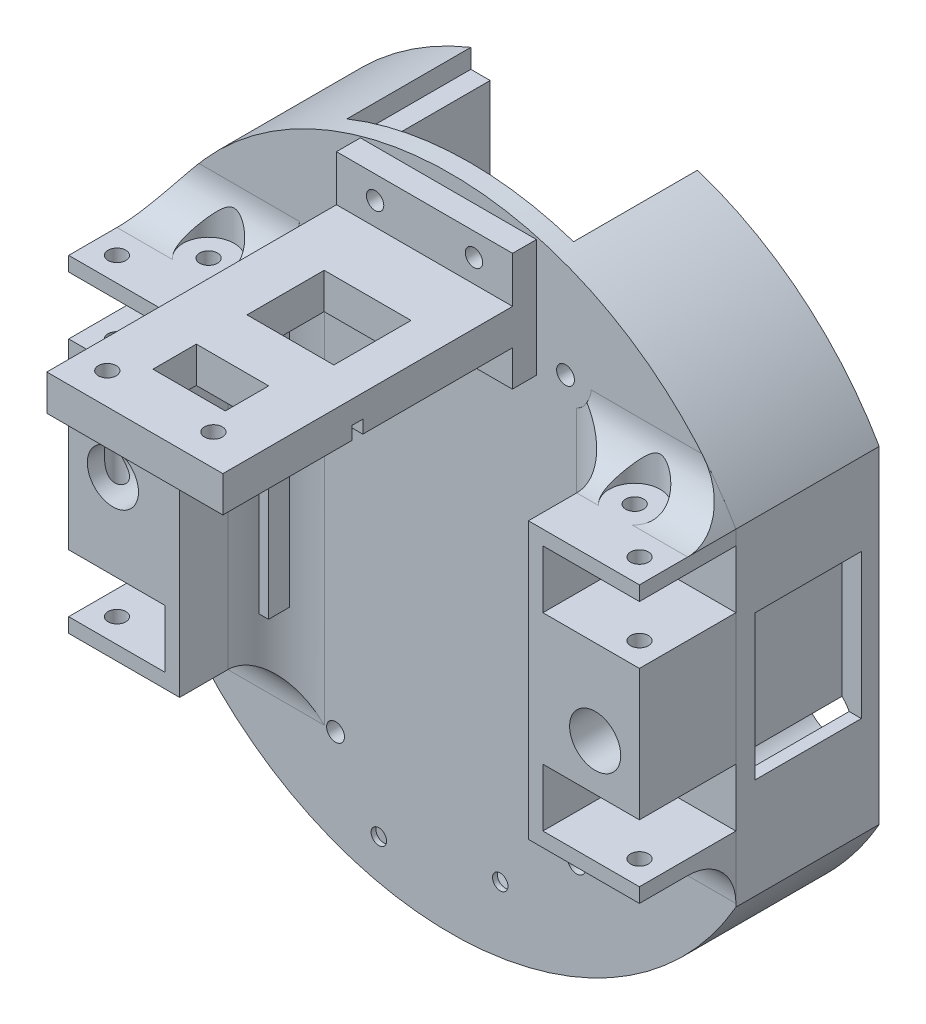
from build123d import *

# Parameters (mm, degrees)
SALIENTE_EXTRUIR2_DEPTH  = 25.7
CROQUIS3_R               = 68.187967498
SALIENTE_EXTRUIR3_DEPTH  = 4
CORTAR_EXTRUIR1_REACH    = 275.509
CROQUIS7_W               = 25
CROQUIS7_H               = 54.5
CORTAR_EXTRUIR2_DEPTH    = 2
CROQUIS8_R               = 1.6
CORTAR_EXTRUIR3_DEPTH    = 10
CROQUIS9_W               = 22
CROQUIS9_H               = 30
CORTAR_EXTRUIR4_DEPTH    = 4
CROQUIS10_R              = 1.85
CORTAR_EXTRUIR5_DEPTH    = 271.994192832
CROQUIS11_W              = 36.494454581
CROQUIS11_H              = 14.83840461
SALIENTE_EXTRUIR4_DEPTH  = 5
CROQUIS12_W              = 36.494454581
CROQUIS12_H              = 7.419202305
SALIENTE_EXTRUIR5_DEPTH  = 60
CROQUIS13_W              = 2.197225814
CROQUIS13_H              = 2.698054226
CORTAR_EXTRUIR6_DEPTH    = 288.011284081
CROQUIS15_W              = 2
CROQUIS15_H              = 49.489125547
SALIENTE_EXTRUIR6_DEPTH  = 6
CROQUIS16_R              = 1.6
CORTAR_EXTRUIR7_DEPTH    = 10
CROQUIS17_R              = 1.85
CORTAR_EXTRUIR8_DEPTH    = 167.163173861
CROQUIS23_W              = 25.422767162
CROQUIS23_H              = 18
CROQUIS23_W_2            = 26.870888419
SALIENTE_EXTRUIR8_DEPTH  = 20
CROQUIS24_W              = 20
CROQUIS24_H              = 12
CROQUIS24_W_2            = 2.422767162
CROQUIS24_H_2            = 18
CROQUIS24_W_3            = 3.870888419
CORTAR_EXTRUIR12_DEPTH   = 20
CROQUIS25_R              = 1.85
CORTAR_EXTRUIR13_DEPTH   = 157.420786096
CROQUIS26_R              = 7
CORTAR_EXTRUIR14_DEPTH   = 23
CORTAR_EXTRUIR15_DEPTH   = 3
CROQUIS28_W              = 15
CROQUIS28_H              = 9
CROQUIS28_W_2            = 18
CROQUIS28_H_2            = 16
CORTAR_EXTRUIR16_DEPTH   = 10
SALIENTE_EXTRUIR9_START  = -7.419202305
CROQUIS29_R              = 1.85
SALIENTE_EXTRUIR9_DEPTH  = 7.419202305
CROQUIS30_W              = 23
CROQUIS30_H              = 31.860199641
CROQUIS30_R              = 5.3
CROQUIS30_H_2            = 21.18941166
SALIENTE_EXTRUIR10_DEPTH = 20
CROQUIS31_R              = 1.85
CORTAR_EXTRUIR17_DEPTH   = 157.420786096
REDONDEO2_R              = 10
CROQUIS32_R              = 5.3
CORTAR_EXTRUIR18_DEPTH   = 278.093418476
CROQUIS33_R              = 5.3
CORTAR_EXTRUIR19_DEPTH   = 10
CORTAR_EXTRUIR21_START   = 10
CROQUIS35_R              = 5.3
CORTAR_EXTRUIR21_DEPTH   = 10
CROQUIS37_R              = 5.3
CORTAR_EXTRUIR23_DEPTH   = 10
CROQUIS38_W              = 4.954639541
CROQUIS38_H              = 9.52618695
SALIENTE_EXTRUIR11_DEPTH = 36.494454581
CROQUIS39_R              = 1.8
CORTAR_EXTRUIR24_DEPTH   = 276.972637799
CORTAR_EXTRUIR25_DEPTH   = 3


with BuildPart() as part:
    # Croquis1 → Saliente-Extruir2 (new body)
    with BuildSketch(Plane.XY):
        with BuildLine():
            Line((-13.423815297, -132.294446721), (-13.423815297, -128.345307712))
            ThreePointArc((-13.423815297, -128.345307712), (-26.08823443, -248.103961959), (80.254008279, -191.589802718))
            ThreePointArc((80.254008279, -191.589802718), (67.366727513, -151.697034471), (33.576184703, -126.883445844))
            Line((33.576184703, -126.883445844), (33.576184703, -153.323488747))
            ThreePointArc((33.576184703, -153.323488747), (49.955618696, -169.422778516), (55.963615617, -191.589802718))
            ThreePointArc((55.963615617, -191.589802718), (49.955618696, -213.756826921), (33.576184703, -229.85611669))
            Line((33.576184703, -229.85611669), (33.576184703, -256.294446721))
            Line((33.576184703, -256.294446721), (-9.423815297, -256.294446721))
            Line((-9.423815297, -256.294446721), (-9.423815297, -229.867513756))
            ThreePointArc((-9.423815297, -229.867513756), (-31.831534056, -191.589802718), (-9.423815297, -153.312091681))
            Line((-9.423815297, -153.312091681), (-9.423815297, -132.294446721))
            Line((-9.423815297, -132.294446721), (-13.423815297, -132.294446721))
        make_face()
    extrude(amount=SALIENTE_EXTRUIR2_DEPTH)

    # Croquis3 → Saliente-Extruir3 (add)
    with BuildSketch(Plane.XY.offset(25.7)):
        with Locations(Location((12.066040781, -191.589802718, 0), (0, 0, 111.951246448))):
            Circle(CROQUIS3_R)
    extrude(amount=SALIENTE_EXTRUIR3_DEPTH)

    # Croquis6 → Cortar-Extruir1 (cut, up to next)
    with BuildSketch(Plane.XY.offset(29.7), mode=Mode.PRIVATE) as cortar_extruir1_sk1:
        with BuildLine():
            Line((-47.08078701, -225.519902539), (-47.08078701, -157.659702898))
            ThreePointArc((-47.08078701, -157.659702898), (-56.121926717, -191.589802718), (-47.08078701, -225.519902539))
        make_face()
    cortar_extruir1_tool1 = extrude(cortar_extruir1_sk1.sketch, amount=-CORTAR_EXTRUIR1_REACH, mode=Mode.PRIVATE) & part.part
    # Croquis6 → Cortar-Extruir1 (cut, up to next)
    with BuildSketch(Plane.XY.offset(29.7), mode=Mode.PRIVATE) as cortar_extruir1_sk2:
        with BuildLine():
            ThreePointArc((80.254008279, -191.589802718), (77.954965808, -174.032796418), (71.212868571, -157.659702898))
            Line((71.212868571, -157.659702898), (71.212868571, -225.519902539))
            ThreePointArc((71.212868571, -225.519902539), (77.954965808, -209.146809019), (80.254008279, -191.589802718))
        make_face()
    cortar_extruir1_tool2 = extrude(cortar_extruir1_sk2.sketch, amount=-CORTAR_EXTRUIR1_REACH, mode=Mode.PRIVATE) & part.part
    add(cortar_extruir1_tool1.solids().sort_by_distance((-50.718614, -191.589803, 29.7))[0], mode=Mode.SUBTRACT)
    add(cortar_extruir1_tool2.solids().sort_by_distance((74.850696, -191.589803, 29.7))[0], mode=Mode.SUBTRACT)

    # Croquis7 → Cortar-Extruir2 (cut)
    with BuildSketch(Plane.ZY.offset(47.08078701)):
        with Locations((15.2, -191.909702898)):
            Rectangle(CROQUIS7_W, CROQUIS7_H)
    extrude(amount=-CORTAR_EXTRUIR2_DEPTH, mode=Mode.SUBTRACT)

    # Croquis8 → Cortar-Extruir3 (cut)
    with BuildSketch(Plane.ZY.offset(45.08078701)):
        with Locations((5.7, -209.159702898)):
            Circle(CROQUIS8_R)
        with Locations((24.7, -174.959702898)):
            Circle(CROQUIS8_R)
    extrude(amount=-CORTAR_EXTRUIR3_DEPTH, mode=Mode.SUBTRACT)

    # Croquis9 → Cortar-Extruir4 (cut)
    with BuildSketch(Plane(origin=(71.212868571, 0, 0), x_dir=(0, 0, -1), z_dir=(1, 0, 0))):
        with Locations((-14.7, -189.659702898)):
            Rectangle(CROQUIS9_W, CROQUIS9_H)
    extrude(amount=-CORTAR_EXTRUIR4_DEPTH, mode=Mode.SUBTRACT)

    # Croquis10 → Cortar-Extruir5 (cut, through all)
    with BuildSketch(Plane(origin=(0, 0, 0), x_dir=(-1, 0, 0), z_dir=(0, 0, -1))):
        with Locations((11.768253413, -235.543487664)):
            Circle(CROQUIS10_R)
        with Locations((-38.213901437, -234.207749444)):
            Circle(CROQUIS10_R)
        with Locations((37.916114069, -192.925540938)):
            Circle(CROQUIS10_R)
        with Locations((-62.048195631, -190.254064499)):
            Circle(CROQUIS10_R)
        with Locations((-35.900334975, -147.636117773)):
            Circle(CROQUIS10_R)
        with Locations((14.081819875, -148.971855993)):
            Circle(CROQUIS10_R)
    extrude(amount=-CORTAR_EXTRUIR5_DEPTH, mode=Mode.SUBTRACT)

    # Croquis11 → Saliente-Extruir4 (add)
    with BuildSketch(Plane.XY.offset(29.7)):
        with Locations((11.63234752, -143.283831758)):
            Rectangle(CROQUIS11_W, CROQUIS11_H)
    extrude(amount=SALIENTE_EXTRUIR4_DEPTH)

    # Croquis12 → Saliente-Extruir5 (add)
    with BuildSketch(Plane.XY.offset(34.7)):
        with Locations((11.63234752, -139.574230606)):
            Rectangle(CROQUIS12_W, CROQUIS12_H)
    extrude(amount=SALIENTE_EXTRUIR5_DEPTH)

    # Croquis13 → Cortar-Extruir6 (cut, through all)
    with BuildSketch(Plane(origin=(29.879574811, 0, 0), x_dir=(0, 0, -1), z_dir=(1, 0, 0))):
        with Locations((-66.794067754, -141.934804645)):
            Rectangle(CROQUIS13_W, CROQUIS13_H)
    extrude(amount=-CORTAR_EXTRUIR6_DEPTH, mode=Mode.SUBTRACT)

    # Croquis15 → Saliente-Extruir6 (add)
    with BuildSketch(Plane.XY.offset(29.7)):
        with Locations((-20.658019848, -191.540467922)):
            Rectangle(CROQUIS15_W, CROQUIS15_H)
        with Locations((43.341980152, -191.540467922)):
            Rectangle(CROQUIS15_W, CROQUIS15_H)
    extrude(amount=SALIENTE_EXTRUIR6_DEPTH)

    # Croquis16 → Cortar-Extruir7 (cut)
    with BuildSketch(Plane.XY.offset(29.7)):
        with Locations((-2.795177489, -249.862416258)):
            Circle(CROQUIS16_R)
        with Locations((22.369152578, -245.40207204)):
            Circle(CROQUIS16_R)
    extrude(amount=-CORTAR_EXTRUIR7_DEPTH, mode=Mode.SUBTRACT)

    # Croquis17 → Cortar-Extruir8 (cut, through all)
    with BuildSketch(Plane(origin=(0, -143.283831758, 0), x_dir=(-1, 0, 0), z_dir=(0, -1, 0))):
        with Locations(Location((0.577969088, -88.2, 0), (0, 0, 90))):
            Circle(CROQUIS17_R)
        with Locations(Location((-10.071096588, -88.2, 0), (0, 0, 90))):
            Circle(CROQUIS17_R)
        with Locations(Location((-21.422030912, -88.2, 0), (0, 0, 90))):
            Circle(CROQUIS17_R)
    extrude(amount=-CORTAR_EXTRUIR8_DEPTH, mode=Mode.SUBTRACT)

    # Croquis23 → Saliente-Extruir8 (add)
    with BuildSketch(Plane.XY.offset(29.7)):
        with Locations((-34.369403429, -166.659702898)):
            Rectangle(CROQUIS23_W, CROQUIS23_H)
        with Locations((-34.369403429, -216.519902539)):
            Rectangle(CROQUIS23_W, CROQUIS23_H)
        with Locations((57.777424362, -166.659702898)):
            Rectangle(CROQUIS23_W_2, CROQUIS23_H)
        with Locations((57.777424362, -205.849114558)):
            Rectangle(CROQUIS23_W_2, CROQUIS23_H)
    extrude(amount=SALIENTE_EXTRUIR8_DEPTH)

    # Croquis24 → Cortar-Extruir12 (cut)
    with BuildSketch(Plane.XY.offset(49.7)):
        with Locations((-37.08078701, -166.659702898)):
            Rectangle(CROQUIS24_W, CROQUIS24_H)
        with Locations((-37.08078701, -216.519902539)):
            Rectangle(CROQUIS24_W, CROQUIS24_H)
        with Locations((61.212868571, -166.659702898)):
            Rectangle(CROQUIS24_W, CROQUIS24_H)
        with Locations((61.212868571, -205.849114558)):
            Rectangle(CROQUIS24_W, CROQUIS24_H)
        with Locations((-22.869403429, -166.659702898)):
            Rectangle(CROQUIS24_W_2, CROQUIS24_H_2)
        with Locations((-22.869403429, -216.519902539)):
            Rectangle(CROQUIS24_W_2, CROQUIS24_H_2)
        with Locations((46.277424362, -166.659702898)):
            Rectangle(CROQUIS24_W_3, CROQUIS24_H_2)
        with Locations((46.277424362, -205.849114558)):
            Rectangle(CROQUIS24_W_3, CROQUIS24_H_2)
    extrude(amount=-CORTAR_EXTRUIR12_DEPTH, mode=Mode.SUBTRACT)

    # Croquis25 → Cortar-Extruir13 (cut, through all)
    with BuildSketch(Plane(origin=(0, -157.659702898, 0), x_dir=(1, 0, 0), z_dir=(0, 1, 0))):
        with Locations(Location((-42.08078701, -44.7, 0), (0, 0, 270))):
            Circle(CROQUIS25_R)
        with Locations(Location((-32.08078701, -35.7, 0), (0, 0, 270))):
            Circle(CROQUIS25_R)
        with Locations(Location((66.233156416, -44.7, 0), (0, 0, 270))):
            Circle(CROQUIS25_R)
        with Locations(Location((56.233156416, -35.7, 0), (0, 0, 270))):
            Circle(CROQUIS25_R)
    extrude(amount=-CORTAR_EXTRUIR13_DEPTH, mode=Mode.SUBTRACT)

    # Croquis26 → Cortar-Extruir14 (cut)
    with BuildSketch(Plane(origin=(0, 0, 0), x_dir=(-1, 0, 0), z_dir=(0, 0, -1))):
        with Locations((34.679916564, -216.470406453)):
            Circle(CROQUIS26_R)
        with Locations((34.679916564, -167.641891075)):
            Circle(CROQUIS26_R)
        with Locations(Location((-58.811998126, -167.641891075, 0), (0, 0, 180))):
            Circle(CROQUIS26_R)
        with Locations(Location((-62.399975323, -207.748824541, 0), (0, 0, 133.436969184))):
            Circle(CROQUIS26_R)
    extrude(amount=-CORTAR_EXTRUIR14_DEPTH, mode=Mode.SUBTRACT)

    # Croquis27 → Cortar-Extruir15 (cut)
    with BuildSketch(Plane(origin=(0, 0, 25.7), x_dir=(-1, 0, 0), z_dir=(0, 0, -1))):
        Polygon((-25.714624157, -247.869422828), (-21.905099905, -249.53301081), (-18.559628325, -247.065660022), (-19.023680998, -242.934721252), (-22.83320525, -241.271133271), (-26.17867683, -243.738484058), align=None)
        Polygon((0.321506024, -253.203216983), (4.451560053, -253.67507895), (6.925231518, -250.334278225), (5.268848954, -246.521615533), (1.138794925, -246.049753566), (-1.33487654, -249.390554291), align=None)
    extrude(amount=-CORTAR_EXTRUIR15_DEPTH, mode=Mode.SUBTRACT)

    # Croquis28 → Cortar-Extruir16 (cut)
    with BuildSketch(Plane(origin=(0, -135.864629453, 0), x_dir=(1, 0, 0), z_dir=(0, 1, 0))):
        with Locations((11.379574811, -78.7)):
            Rectangle(CROQUIS28_W, CROQUIS28_H)
        with Locations((12.879574811, -55.7)):
            Rectangle(CROQUIS28_W_2, CROQUIS28_H_2)
    extrude(amount=-CORTAR_EXTRUIR16_DEPTH, mode=Mode.SUBTRACT)

    # Croquis29 → Saliente-Extruir9 (add)
    with BuildSketch(Plane(origin=(0, -135.864629453, 0), x_dir=(1, 0, 0), z_dir=(0, 1, 0)).offset(SALIENTE_EXTRUIR9_START)):
        with Locations((10.071096588, -88.2)):
            Circle(CROQUIS29_R)
    extrude(amount=SALIENTE_EXTRUIR9_DEPTH)

    # Croquis30 → Saliente-Extruir10 (add)
    # profile 1 of 2: a face of its own
    with BuildSketch(Plane.XY.offset(29.7)):
        with Locations((-35.58078701, -191.589802719)):
            Rectangle(CROQUIS30_W, CROQUIS30_H)
        with Locations((-37.916114069, -192.925540938)):
            Circle(CROQUIS30_R, mode=Mode.SUBTRACT)
    # profile 2 of 2: a face of its own
    with BuildSketch(Plane.XY.offset(29.7)):
        with Locations((59.712868571, -186.254408728)):
            Rectangle(CROQUIS30_W, CROQUIS30_H_2)
        with Locations((62.048195631, -190.254064499)):
            Circle(CROQUIS30_R, mode=Mode.SUBTRACT)
    extrude(amount=SALIENTE_EXTRUIR10_DEPTH)

    # Croquis31 → Cortar-Extruir17 (cut, through all)
    with BuildSketch(Plane.XZ.offset(225.519902539)):
        with Locations(Location((-42.08078701, 44.7, 0), (0, 0, 90))):
            Circle(CROQUIS31_R)
        with Locations(Location((-32.08078701, 35.7, 0), (0, 0, 90))):
            Circle(CROQUIS31_R)
        with Locations(Location((56.233156416, 35.7, 0), (0, 0, 90))):
            Circle(CROQUIS31_R)
        with Locations(Location((66.233156416, 44.7, 0), (0, 0, 90))):
            Circle(CROQUIS31_R)
    extrude(amount=-CORTAR_EXTRUIR17_DEPTH, mode=Mode.SUBTRACT)

    # Redondeo2
    # the kernel refuses this fillet: 10 mm, written as the material it adds along each edge
    with BuildSketch(Plane(origin=(-47.08078701, -225.519902539, 29.7), x_dir=(0, -1, 0), z_dir=(1, 0, 0))) as redondeo2_piece_1_section:
        with BuildLine():
            CenterArc((REDONDEO2_R, -REDONDEO2_R), REDONDEO2_R, 90, 90)
            Line((0, -REDONDEO2_R), (0, 0))
            Line((0, 0), (REDONDEO2_R, 0))
        make_face()
    redondeo2_piece_1 = extrude(amount=23, mode=Mode.PRIVATE)
    redondeo2_piece_1 = redondeo2_piece_1 & Plane(origin=(12.066040781, -191.589802718, 31.973355748), x_dir=(-0.3738175078844624, 0.9275022753605783, 0), z_dir=(0, 0, -1)) * Cylinder(68.187967498, 86, mode=Mode.PRIVATE)
    redondeo2_piece_1 = redondeo2_piece_1 - Plane(origin=(-32.08078701, -227.679625959, 35.7), x_dir=(0, 0, 1), z_dir=(0, 1, 0)) * Cylinder(1.85, 86, mode=Mode.PRIVATE)
    add(redondeo2_piece_1)
    with BuildSketch(Plane(origin=(71.212868571, -157.659702898, 29.7), x_dir=(0, 1, 0), z_dir=(-1, 0, 0))) as redondeo2_piece_2_section:
        with BuildLine():
            CenterArc((REDONDEO2_R, -REDONDEO2_R), REDONDEO2_R, 90, 90)
            Line((0, -REDONDEO2_R), (0, 0))
            Line((0, 0), (REDONDEO2_R, 0))
        make_face()
    redondeo2_piece_2 = extrude(amount=23, mode=Mode.PRIVATE)
    redondeo2_piece_2 = redondeo2_piece_2 & Plane(origin=(12.066040781, -191.589802718, 31.973351105), x_dir=(-0.3738175078844624, 0.9275022753605783, 0), z_dir=(0, 0, -1)) * Cylinder(68.187967498, 87, mode=Mode.PRIVATE)
    redondeo2_piece_2 = redondeo2_piece_2 - Plane(origin=(56.233156416, -155.49997883, 35.7), x_dir=(0, 0, 1), z_dir=(0, 1, 0)) * Cylinder(1.85, 87, mode=Mode.PRIVATE)
    add(redondeo2_piece_2)
    with BuildSketch(Plane(origin=(71.212868571, -214.849114558, 29.7), x_dir=(0, -1, 0), z_dir=(-1, 0, 0))) as redondeo2_piece_3_section:
        with BuildLine():
            CenterArc((REDONDEO2_R, REDONDEO2_R), REDONDEO2_R, 180, 90)
            Line((0, REDONDEO2_R), (0, 0))
            Line((0, 0), (REDONDEO2_R, 0))
        make_face()
    redondeo2_piece_3 = extrude(amount=23, mode=Mode.PRIVATE)
    redondeo2_piece_3 = redondeo2_piece_3 - Plane(origin=(56.233156416, -217.15062126, 35.7), x_dir=(0, 0, 1), z_dir=(0, 1, 0)) * Cylinder(1.85, 87, mode=Mode.PRIVATE)
    add(redondeo2_piece_3)
    with BuildSketch(Plane(origin=(-47.08078701, -157.659702898, 29.7), x_dir=(0, 1, 0), z_dir=(1, 0, 0))) as redondeo2_piece_4_section:
        with BuildLine():
            CenterArc((REDONDEO2_R, REDONDEO2_R), REDONDEO2_R, 180, 90)
            Line((0, REDONDEO2_R), (0, 0))
            Line((0, 0), (REDONDEO2_R, 0))
        make_face()
    redondeo2_piece_4 = extrude(amount=23, mode=Mode.PRIVATE)
    redondeo2_piece_4 = redondeo2_piece_4 & Plane(origin=(12.066040781, -191.589802718, 31.973356861), x_dir=(-0.3738175078844624, 0.9275022753605783, 0), z_dir=(0, 0, -1)) * Cylinder(68.187967498, 86, mode=Mode.PRIVATE)
    redondeo2_piece_4 = redondeo2_piece_4 - Plane(origin=(-32.08078701, -155.49997901, 35.7), x_dir=(0, 0, 1), z_dir=(0, 1, 0)) * Cylinder(1.85, 86, mode=Mode.PRIVATE)
    add(redondeo2_piece_4)
    with BuildSketch(Plane(origin=(-24.08078701, -157.659702898, 29.7), x_dir=(1, 0, 0), z_dir=(0, -1, 0))) as redondeo2_piece_5:
        with BuildLine():
            CenterArc((REDONDEO2_R, REDONDEO2_R), REDONDEO2_R, 180, 90)
            Line((0, REDONDEO2_R), (0, 0))
            Line((0, 0), (REDONDEO2_R, 0))
        make_face()
    extrude(amount=67.86019964)
    with BuildSketch(Plane(origin=(48.212868571, -214.849114558, 29.7), x_dir=(-1, 0, 0), z_dir=(0, 1, 0))) as redondeo2_piece_6:
        with BuildLine():
            CenterArc((REDONDEO2_R, REDONDEO2_R), REDONDEO2_R, 180, 90)
            Line((0, REDONDEO2_R), (0, 0))
            Line((0, 0), (REDONDEO2_R, 0))
        make_face()
    extrude(amount=57.18941166)
    with BuildSketch(Plane(origin=(-24.08078701, -157.659702898, 29.7), x_dir=(1, 0, 0), z_dir=(0, -1, 0))) as redondeo2_piece_7a_section:
        with BuildLine():
            CenterArc((REDONDEO2_R, REDONDEO2_R), REDONDEO2_R, 180, 90)
            Line((0, REDONDEO2_R), (0, 0))
            Line((0, 0), (REDONDEO2_R, 0))
        make_face()
    redondeo2_piece_7a = extrude(amount=92.86019964, mode=Mode.PRIVATE)
    redondeo2_piece_7a = redondeo2_piece_7a & Plane(origin=(12.066040781, -191.589802718, 31.940610005), x_dir=(-0.3738175078844624, 0.9275022753605783, 0), z_dir=(0, 0, -1)) * Cylinder(68.187967498, 226, mode=Mode.PRIVATE)
    redondeo2_piece_7a = split(redondeo2_piece_7a, bisect_by=Plane(origin=(-21.788201619, -225.519902539, 31.940610005), z_dir=(0, -1, 0)), keep=Keep.TOP, mode=Mode.PRIVATE)
    with BuildSketch(Plane(origin=(-47.08078701, -225.519902539, 29.7), x_dir=(0, -1, 0), z_dir=(1, 0, 0))) as redondeo2_piece_7b_section:
        with BuildLine():
            CenterArc((REDONDEO2_R, -REDONDEO2_R), REDONDEO2_R, 90, 90)
            Line((0, -REDONDEO2_R), (0, 0))
            Line((0, 0), (REDONDEO2_R, 0))
        make_face()
    redondeo2_piece_7b = extrude(amount=48, mode=Mode.PRIVATE)
    redondeo2_piece_7b = redondeo2_piece_7b - Plane(origin=(-11.768253413, -235.543487664, 31.968653501), x_dir=(-1, 0, 0), z_dir=(0, 0, -1)) * Cylinder(1.85, 136, mode=Mode.PRIVATE)
    redondeo2_piece_7b = split(redondeo2_piece_7b, bisect_by=Plane(origin=(-24.08078701, -227.77002234, 31.968653501), z_dir=(1, 0, 0)), keep=Keep.TOP, mode=Mode.PRIVATE)
    redondeo2_piece_7 = redondeo2_piece_7a & redondeo2_piece_7b
    add(redondeo2_piece_7)
    with BuildSketch(Plane(origin=(71.212868571, -157.659702898, 29.7), x_dir=(0, 1, 0), z_dir=(-1, 0, 0))) as redondeo2_piece_8a_section:
        with BuildLine():
            CenterArc((REDONDEO2_R, -REDONDEO2_R), REDONDEO2_R, 90, 90)
            Line((0, -REDONDEO2_R), (0, 0))
            Line((0, 0), (REDONDEO2_R, 0))
        make_face()
    redondeo2_piece_8a = extrude(amount=48, mode=Mode.PRIVATE)
    redondeo2_piece_8a = redondeo2_piece_8a - Plane(origin=(35.900334975, -147.636117773, 31.968653501), x_dir=(-1, 0, 0), z_dir=(0, 0, -1)) * Cylinder(1.85, 137, mode=Mode.PRIVATE)
    redondeo2_piece_8a = split(redondeo2_piece_8a, bisect_by=Plane(origin=(48.212868571, -155.409583097, 31.968653501), z_dir=(-1, 0, 0)), keep=Keep.TOP, mode=Mode.PRIVATE)
    with BuildSketch(Plane(origin=(48.212868571, -214.849114558, 29.7), x_dir=(-1, 0, 0), z_dir=(0, 1, 0))) as redondeo2_piece_8b_section:
        with BuildLine():
            CenterArc((REDONDEO2_R, REDONDEO2_R), REDONDEO2_R, 180, 90)
            Line((0, REDONDEO2_R), (0, 0))
            Line((0, 0), (REDONDEO2_R, 0))
        make_face()
    redondeo2_piece_8b = extrude(amount=82.18941166, mode=Mode.PRIVATE)
    redondeo2_piece_8b = redondeo2_piece_8b & Plane(origin=(12.066040781, -191.589802718, 31.940610005), x_dir=(-0.3738175078844624, 0.9275022753605783, 0), z_dir=(0, 0, -1)) * Cylinder(68.187967498, 205, mode=Mode.PRIVATE)
    redondeo2_piece_8b = split(redondeo2_piece_8b, bisect_by=Plane(origin=(45.920283181, -157.659702898, 31.940610005), z_dir=(0, 1, 0)), keep=Keep.TOP, mode=Mode.PRIVATE)
    redondeo2_piece_8 = redondeo2_piece_8a & redondeo2_piece_8b
    add(redondeo2_piece_8)
    with BuildSketch(Plane(origin=(71.212868571, -214.849114558, 29.7), x_dir=(0, -1, 0), z_dir=(-1, 0, 0))) as redondeo2_piece_9a_section:
        with BuildLine():
            CenterArc((REDONDEO2_R, REDONDEO2_R), REDONDEO2_R, 180, 90)
            Line((0, REDONDEO2_R), (0, 0))
            Line((0, 0), (REDONDEO2_R, 0))
        make_face()
    redondeo2_piece_9a = extrude(amount=48, mode=Mode.PRIVATE)
    redondeo2_piece_9a = split(redondeo2_piece_9a, bisect_by=Plane(origin=(48.212868571, -217.113065701, 31.963951143), z_dir=(-1, 0, 0)), keep=Keep.TOP, mode=Mode.PRIVATE)
    with BuildSketch(Plane(origin=(48.212868571, -239.849114558, 29.7), x_dir=(-1, 0, 0), z_dir=(0, 1, 0))) as redondeo2_piece_9b_section:
        with BuildLine():
            CenterArc((REDONDEO2_R, REDONDEO2_R), REDONDEO2_R, 180, 90)
            Line((0, REDONDEO2_R), (0, 0))
            Line((0, 0), (REDONDEO2_R, 0))
        make_face()
    redondeo2_piece_9b = extrude(amount=82.18941166, mode=Mode.PRIVATE)
    redondeo2_piece_9b = redondeo2_piece_9b - Plane(origin=(38.213901437, -234.207749444, 31.968757172), x_dir=(-1, 0, 0), z_dir=(0, 0, -1)) * Cylinder(1.85, 205, mode=Mode.PRIVATE)
    redondeo2_piece_9b = split(redondeo2_piece_9b, bisect_by=Plane(origin=(45.963029378, -214.849114558, 31.968757172), z_dir=(0, -1, 0)), keep=Keep.TOP, mode=Mode.PRIVATE)
    redondeo2_piece_9 = redondeo2_piece_9a & redondeo2_piece_9b
    add(redondeo2_piece_9)
    with BuildSketch(Plane(origin=(-47.08078701, -157.659702898, 29.7), x_dir=(0, 1, 0), z_dir=(1, 0, 0))) as redondeo2_piece_10a_section:
        with BuildLine():
            CenterArc((REDONDEO2_R, REDONDEO2_R), REDONDEO2_R, 180, 90)
            Line((0, REDONDEO2_R), (0, 0))
            Line((0, 0), (REDONDEO2_R, 0))
        make_face()
    redondeo2_piece_10a = extrude(amount=48, mode=Mode.PRIVATE)
    redondeo2_piece_10a = redondeo2_piece_10a - Plane(origin=(-14.081819875, -148.971855993, 31.97595745), x_dir=(-1, 0, 0), z_dir=(0, 0, -1)) * Cylinder(1.85, 136, mode=Mode.PRIVATE)
    redondeo2_piece_10a = split(redondeo2_piece_10a, bisect_by=Plane(origin=(-24.08078701, -155.427355558, 31.97595745), z_dir=(1, 0, 0)), keep=Keep.TOP, mode=Mode.PRIVATE)
    with BuildSketch(Plane(origin=(-24.08078701, -132.659702898, 29.7), x_dir=(1, 0, 0), z_dir=(0, -1, 0))) as redondeo2_piece_10b_section:
        with BuildLine():
            CenterArc((REDONDEO2_R, REDONDEO2_R), REDONDEO2_R, 180, 90)
            Line((0, REDONDEO2_R), (0, 0))
            Line((0, 0), (REDONDEO2_R, 0))
        make_face()
    redondeo2_piece_10b = extrude(amount=92.86019964, mode=Mode.PRIVATE)
    redondeo2_piece_10b = redondeo2_piece_10b & Plane(origin=(12.066040781, -191.589802718, 31.945440695), x_dir=(-0.3738175078844624, 0.9275022753605783, 0), z_dir=(0, 0, -1)) * Cylinder(68.187967498, 226, mode=Mode.PRIVATE)
    redondeo2_piece_10b = redondeo2_piece_10b - Plane(origin=(-14.081819875, -148.971855993, 31.945440695), x_dir=(-1, 0, 0), z_dir=(0, 0, -1)) * Cylinder(1.85, 226, mode=Mode.PRIVATE)
    redondeo2_piece_10b = split(redondeo2_piece_10b, bisect_by=Plane(origin=(-21.802469491, -157.659702898, 31.945440695), z_dir=(0, 1, 0)), keep=Keep.TOP, mode=Mode.PRIVATE)
    redondeo2_piece_10 = redondeo2_piece_10a & redondeo2_piece_10b
    add(redondeo2_piece_10)

    # Croquis32 → Cortar-Extruir18 (cut, through all)
    with BuildSketch(Plane.XY.offset(29.7)):
        with Locations((-14.081819875, -148.971855993)):
            Circle(CROQUIS32_R)
        with Locations((35.900334975, -147.636117773)):
            Circle(CROQUIS32_R)
    extrude(amount=CORTAR_EXTRUIR18_DEPTH, mode=Mode.SUBTRACT)

    # Croquis33 → Cortar-Extruir19 (cut)
    with BuildSketch(Plane.XZ.offset(225.519902539)):
        with Locations((-32.08078701, 35.7)):
            Circle(CROQUIS33_R)
        with Locations((56.233156416, 35.7)):
            Circle(CROQUIS33_R)
    extrude(amount=CORTAR_EXTRUIR19_DEPTH, mode=Mode.SUBTRACT)

    # Croquis35 → Cortar-Extruir21 (cut)
    with BuildSketch(Plane(origin=(0, -157.659702898, 0), x_dir=(1, 0, 0), z_dir=(0, 1, 0)).offset(CORTAR_EXTRUIR21_START)):
        with Locations((-32.08078701, -35.7)):
            Circle(CROQUIS35_R)
        with Locations((56.233156416, -35.7)):
            Circle(CROQUIS35_R)
    extrude(amount=-CORTAR_EXTRUIR21_DEPTH, mode=Mode.SUBTRACT)

    # Croquis37 → Cortar-Extruir23 (cut)
    with BuildSketch(Plane.XZ.offset(214.849114558)):
        with Locations((56.233156416, 35.7)):
            Circle(CROQUIS37_R)
    extrude(amount=CORTAR_EXTRUIR23_DEPTH, mode=Mode.SUBTRACT)

    # Croquis38 → Saliente-Extruir11 (add)
    with BuildSketch(Plane.ZY.offset(6.61487977)):
        with Locations((32.179910053, -131.101535978)):
            Rectangle(CROQUIS38_W, CROQUIS38_H)
    extrude(amount=-SALIENTE_EXTRUIR11_DEPTH)

    # Croquis39 → Cortar-Extruir24 (cut, through all)
    with BuildSketch(Plane.XY.offset(34.657229823)):
        with Locations((1.38512023, -131.101535978)):
            Circle(CROQUIS39_R)
        with Locations((21.879574811, -131.101535978)):
            Circle(CROQUIS39_R)
    extrude(amount=-CORTAR_EXTRUIR24_DEPTH, mode=Mode.SUBTRACT)

    # Croquis40 → Cortar-Extruir25 (cut)
    with BuildSketch(Plane(origin=(0, 0, 25.7), x_dir=(-1, 0, 0), z_dir=(0, 0, -1))):
        Polygon((-18.52315598, -132.780162192), (-18.747632451, -129.034105112), (-22.104051281, -127.355478898), (-25.235993642, -129.422909764), (-25.011517171, -133.168966844), (-21.655098341, -134.847593058), align=None)
        Polygon((-0.464161648, -134.739553106), (2.225974313, -132.122971014), (1.305015732, -128.484953886), (-2.306078811, -127.46351885), (-4.996214773, -130.080100941), (-4.075256191, -133.718118069), align=None)
    extrude(amount=-CORTAR_EXTRUIR25_DEPTH, mode=Mode.SUBTRACT)


with BuildPart() as body_2:
    # Partir1: the piece on the far side of the plane
    add(part.part)
    split(bisect_by=Plane.XY.offset(29.7), keep=Keep.BOTTOM)


with BuildPart() as part_1:
    add(part.part)

    # Partir1
    split(bisect_by=Plane.XY.offset(29.7), keep=Keep.TOP)


solid = Compound([body_2.part, part_1.part])
